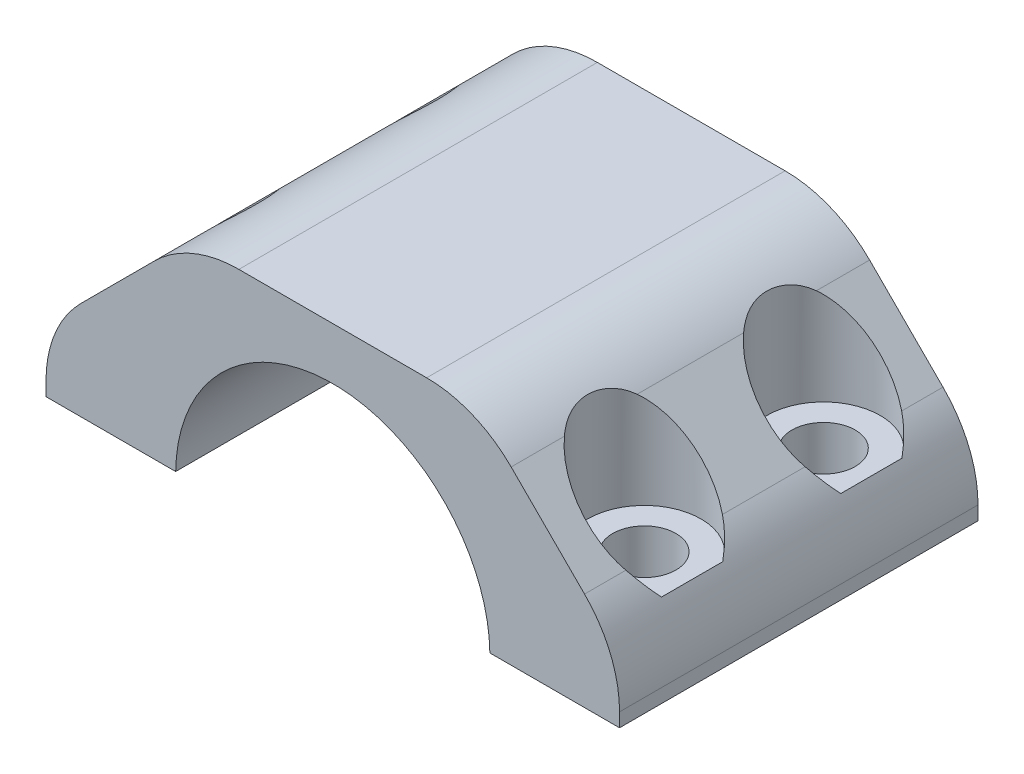
from build123d import *

# Parameters (mm, degrees)
SKETCH1_W              = 48
SKETCH1_H              = 17.5
BODY_DEPTH             = 30
TUBE_CUTOUT_DEPTH      = 40.402569713
SKETCH3_R              = 2.65
CUT_EXTRUDE_M5_DEPTH   = 43.216702856
SLOPE_DEPTH            = 40.402569713
BOLT_HEAD_CUTOUT_START = -6.5
SKETCH5_R              = 4.75
BOLT_HEAD_CUTOUT_DEPTH = 23
FILLET_2_R             = 10
SKETCH7_W              = 48
SKETCH7_H              = 30
CLEARANCE_DEPTH        = 0.2


with BuildPart() as part:
    # Sketch1 → body (new body)
    with BuildSketch(Plane.XY):
        Rectangle(SKETCH1_W, SKETCH1_H)
    extrude(amount=BODY_DEPTH)

    # Sketch2 → tube_cutout (cut, through all)
    with BuildSketch(Plane.XY):
        with BuildLine():
            Line((13.15, -8.75), (-13.15, -8.75))
            ThreePointArc((-13.15, -8.75), (0, 4.4), (13.15, -8.75))
        make_face()
    extrude(amount=TUBE_CUTOUT_DEPTH, mode=Mode.SUBTRACT)

    # Sketch3 → Cut-Extrude M5 (cut, through all)
    with BuildSketch(Plane.XZ.offset(8.75)):
        with Locations(Location((18.575, 22.5, 0), (0, 0, 270))):
            Circle(SKETCH3_R)
        with Locations(Location((18.575, 7.5, 0), (0, 0, 270))):
            Circle(SKETCH3_R)
        with Locations(Location((-18.575, 7.5, 0), (0, 0, 90))):
            Circle(SKETCH3_R)
        with Locations(Location((-18.575, 22.5, 0), (0, 0, 90))):
            Circle(SKETCH3_R)
    extrude(amount=-CUT_EXTRUDE_M5_DEPTH, mode=Mode.SUBTRACT)

    # Sketch4 → slope (cut, through all)
    with BuildSketch(Plane.XY):
        Polygon((-24, 8.75), (-24, -3.25), (-12, 8.75), align=None)
        Polygon((24, -3.25), (12, 8.75), (24, 8.75), align=None)
    extrude(amount=SLOPE_DEPTH, mode=Mode.SUBTRACT)

    # Sketch5 → bolt_head_cutout (cut)
    with BuildSketch(Plane.XZ.offset(8.75).offset(BOLT_HEAD_CUTOUT_START)):
        with Locations((18.575, 22.5)):
            Circle(SKETCH5_R)
        with Locations((18.575, 7.5)):
            Circle(SKETCH5_R)
        with Locations((-18.575, 7.5)):
            Circle(SKETCH5_R)
        with Locations((-18.575, 22.5)):
            Circle(SKETCH5_R)
    extrude(amount=-BOLT_HEAD_CUTOUT_DEPTH, mode=Mode.SUBTRACT)

    # fillet 2
    # the kernel refuses this fillet: 10 mm, written as the material it takes off along each edge
    with BuildSketch(Plane(origin=(24, -3.25, -10.355339059), x_dir=(-0.7071067811865475, 0.7071067811865478, 0), z_dir=(0, 0, 1)), Plane(origin=(12, 8.75, -10.355339059), x_dir=(-1, 0, 0), z_dir=(0, 0, 1)), Plane(origin=(-12, 8.75, -10.355339059), x_dir=(-0.7071067811865474, -0.7071067811865478, 0), z_dir=(0, 0, 1))) as fillet_2_piece_1:
        with BuildLine():
            CenterArc((FILLET_2_R * 0.414213562373, FILLET_2_R), FILLET_2_R, 225, 45)
            Line((-FILLET_2_R * 0.292893218813, FILLET_2_R * 0.292893218813), (0, 0))
            Line((0, 0), (FILLET_2_R * 0.414213562373, 0))
        make_face()
    extrude(amount=50.710678119, mode=Mode.SUBTRACT)
    with BuildSketch(Plane(origin=(-24, -3.25, -10.355339059), x_dir=(0.7071067811865469, 0.707106781186548, 0), z_dir=(0, 0, 1))) as fillet_2_piece_2:
        with BuildLine():
            CenterArc((FILLET_2_R * 0.414213562373, -FILLET_2_R), FILLET_2_R, 90, 45)
            Line((-FILLET_2_R * 0.292893218813, -FILLET_2_R * 0.292893218813), (0, 0))
            Line((0, 0), (FILLET_2_R * 0.414213562373, 0))
        make_face()
    extrude(amount=50.710678119, mode=Mode.SUBTRACT)

    # Sketch7 → clearance (cut)
    with BuildSketch(Plane.XZ.offset(8.75)):
        with Locations((0, 15)):
            Rectangle(SKETCH7_W, SKETCH7_H)
    extrude(amount=-CLEARANCE_DEPTH, mode=Mode.SUBTRACT)


solid = part.part
